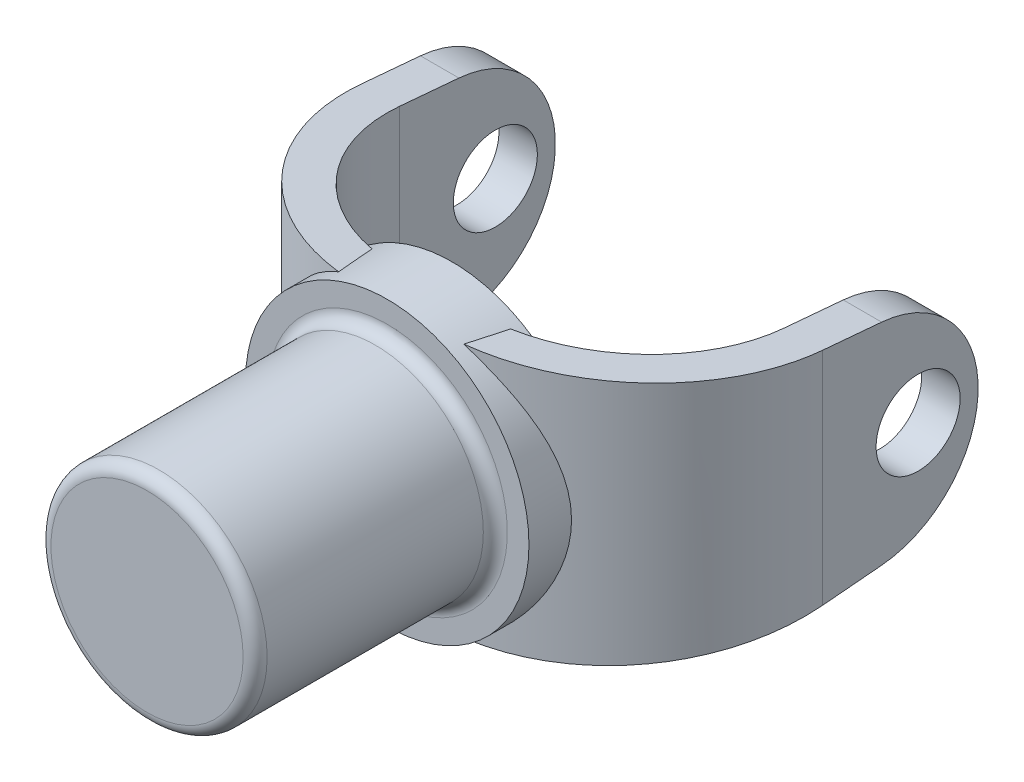
from build123d import *
from build123d.topology import SkipClean

# Parameters (mm, degrees)
SKETCH1_R           = 225
BOSS_EXTRUDE1_DEPTH = 500
SKETCH2_R           = 295
BOSS_EXTRUDE2_DEPTH = 135
FILLET1_R           = 25
BOSS_EXTRUDE3_DEPTH = 274
SKETCH7_R           = 87.5
CUT_EXTRUDE1_DEPTH  = 548
SKETCH8_R           = 295
BOSS_EXTRUDE4_DEPTH = 135


with BuildPart() as part:
    # Sketch1 → Boss-Extrude1 (new body)
    with BuildSketch(Plane.XY):
        Circle(SKETCH1_R)
    extrude(amount=-BOSS_EXTRUDE1_DEPTH)

    # Sketch2 → Boss-Extrude2 (add)
    with BuildSketch(Plane(origin=(0, 0, -500), x_dir=(-1, 0, 0), z_dir=(0, 0, -1))):
        Circle(SKETCH2_R)
    extrude(amount=BOSS_EXTRUDE2_DEPTH)

    # Fillet1
    fillet1_edges = [part.edges().sort_by_distance(p)[0] for p in [
        (-225, 0, 0),
        (-225, 0, -500),
    ]]
    fillet(fillet1_edges, radius=FILLET1_R)

    # Sketch5 → Boss-Extrude3 (add, symmetric)
    with BuildSketch(Plane(origin=(0, 0, 0), x_dir=(1, 0, 0), z_dir=(0, 1, 0))):
        with BuildLine():
            Line((0, 525.936531369), (-80, 525.936531369))
            ThreePointArc((-80, 525.936531369), (-362.842712475, 643.093818894), (-480, 925.936531369))
            Line((-480, 925.936531369), (-480, 1250))
            Line((-480, 1250), (-400, 1250))
            Line((-400, 1250), (-400, 925.936531369))
            ThreePointArc((-400, 925.936531369), (-306.27416998, 699.662361389), (-80, 605.936531369))
            Line((-80, 605.936531369), (0, 605.936531369))
            Line((0, 605.936531369), (0, 525.936531369))
        make_face()
    boss_extrude3 = extrude(amount=BOSS_EXTRUDE3_DEPTH, both=True)

    # Sketch7 → Cut-Extrude1 (cut)
    with BuildSketch(Plane(origin=(0, 0, 0), x_dir=(0, 0, -1), z_dir=(1, 0, 0))):
        with Locations((1125, 0)):
            Circle(SKETCH7_R)
        with BuildLine():
            Line((1049.174263404, 219.16283358), (203.039318936, 293.190049034))
            Line((203.039318936, 293.190049034), (290.021270447, 513.829798209))
            Line((290.021270447, 513.829798209), (1323.371387979, 627.428253954))
            Line((1323.371387979, 627.428253954), (2049.606507286, -712.594868551))
            Line((2049.606507286, -712.594868551), (1049.174263404, -1026.824287114))
            Line((1049.174263404, -1026.824287114), (203.039318936, -293.190049034))
            Line((203.039318936, -293.190049034), (1049.174263404, -219.16283358))
            ThreePointArc((1049.174263404, -219.16283358), (1250, 0), (1049.174263404, 219.16283358))
        make_face()
    cut_extrude1 = extrude(amount=-CUT_EXTRUDE1_DEPTH, mode=Mode.SUBTRACT)

    # Sketch8 → Boss-Extrude4 (add)
    with BuildSketch(Plane.XY.offset(-500)):
        with Locations(Location((0, 0, 0), (0, 0, 243.787314881))):
            Circle(SKETCH8_R)
    boss_extrude4 = extrude(amount=-BOSS_EXTRUDE4_DEPTH)

    # Mirror3: Boss-Extrude3, Cut-Extrude1, Boss-Extrude4 across plane
    with SkipClean():  # the faces are left unmerged after this step: merging them gives an invalid solid
        add(boss_extrude3.mirror(Plane(origin=(0, 0, 0), x_dir=(0, 0, 1), z_dir=(1, 0, 0))))
        add(cut_extrude1.mirror(Plane(origin=(0, 0, 0), x_dir=(0, 0, 1), z_dir=(1, 0, 0))), mode=Mode.SUBTRACT)
        add(boss_extrude4.mirror(Plane(origin=(0, 0, 0), x_dir=(0, 0, 1), z_dir=(1, 0, 0))))
    add(part.part.scale(1), mode=Mode.REPLACE)  # the faces are merged on a copy


solid = part.part
